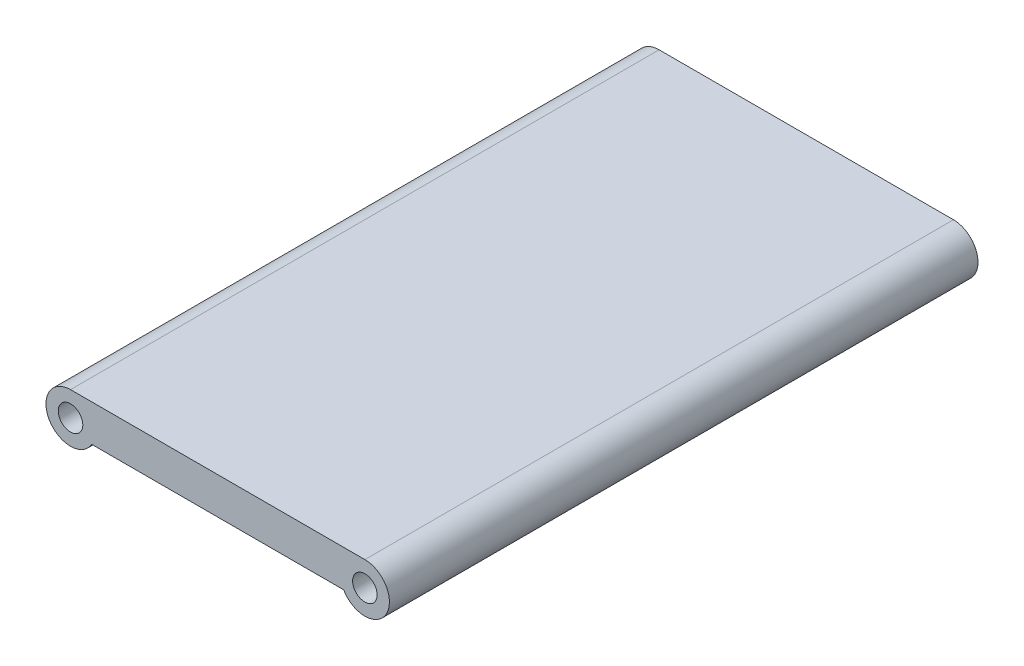
from build123d import *

# Parameters (mm, degrees)
BOSS_EXTRUDE1_DEPTH = 152.4
SKETCH3_R           = 3.175
CUT_EXTRUDE1_DEPTH  = 159.879400052


with BuildPart() as part:
    # Sketch2 → Boss-Extrude1 (new body)
    with BuildSketch(Plane.XY):
        with BuildLine():
            Line((-38.108759104, 6.35), (38.108759104, 6.35))
            ThreePointArc((38.108759104, 6.35), (43.608020418, -3.175), (32.60949779, -3.175))
            Line((32.60949779, -3.175), (-32.60949779, -3.175))
            ThreePointArc((-32.60949779, -3.175), (-43.608020418, -3.175), (-38.108759104, 6.35))
        make_face()
    extrude(amount=BOSS_EXTRUDE1_DEPTH)

    # Sketch3 → Cut-Extrude1 (cut, through all)
    with BuildSketch(Plane(origin=(0, 0, 0), x_dir=(-1, 0, 0), z_dir=(0, 0, -1))):
        with Locations((-38.108759104, 0)):
            Circle(SKETCH3_R)
        with Locations((38.108759104, 0)):
            Circle(SKETCH3_R)
    extrude(amount=-CUT_EXTRUDE1_DEPTH, mode=Mode.SUBTRACT)


solid = part.part
